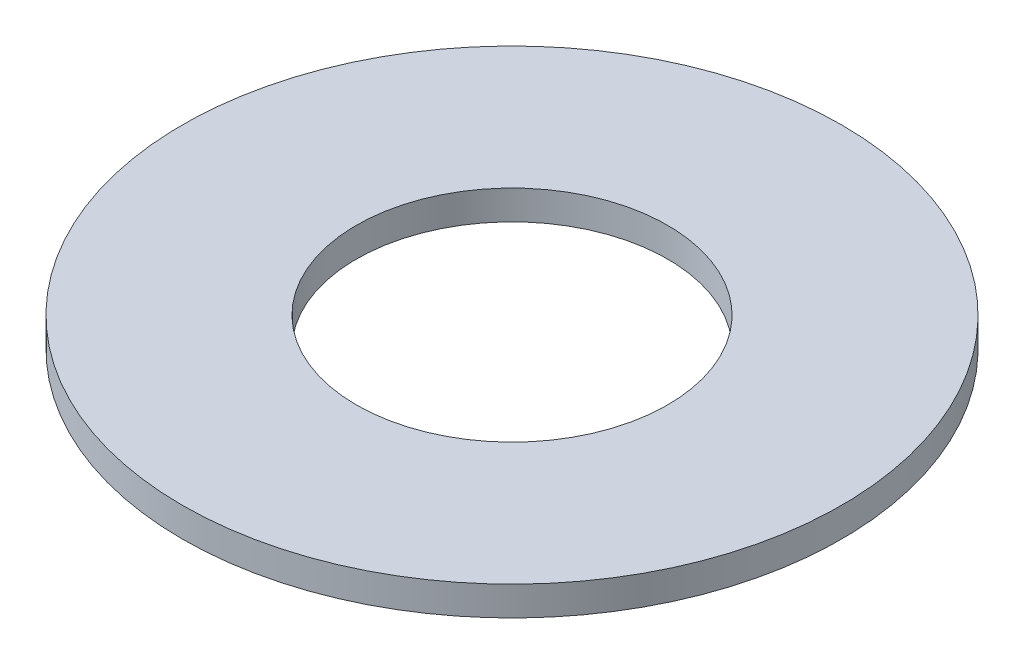
from build123d import *

# Parameters (mm, degrees)
SKETCH1_R           = 90
BOSS_EXTRUDE1_DEPTH = 8
SKETCH2_R           = 42.5
CUT_EXTRUDE1_DEPTH  = 128.530388535


with BuildPart() as part:
    # Sketch1 → Boss-Extrude1 (new body)
    with BuildSketch(Plane(origin=(0, 0, 0), x_dir=(1, 0, 0), z_dir=(0, 1, 0))):
        Circle(SKETCH1_R)
    extrude(amount=BOSS_EXTRUDE1_DEPTH)

    # Sketch2 → Cut-Extrude1 (cut, through all)
    with BuildSketch(Plane(origin=(0, 0, 0), x_dir=(1, 0, 0), z_dir=(0, 1, 0))):
        Circle(SKETCH2_R)
    extrude(amount=CUT_EXTRUDE1_DEPTH, mode=Mode.SUBTRACT)


solid = part.part
